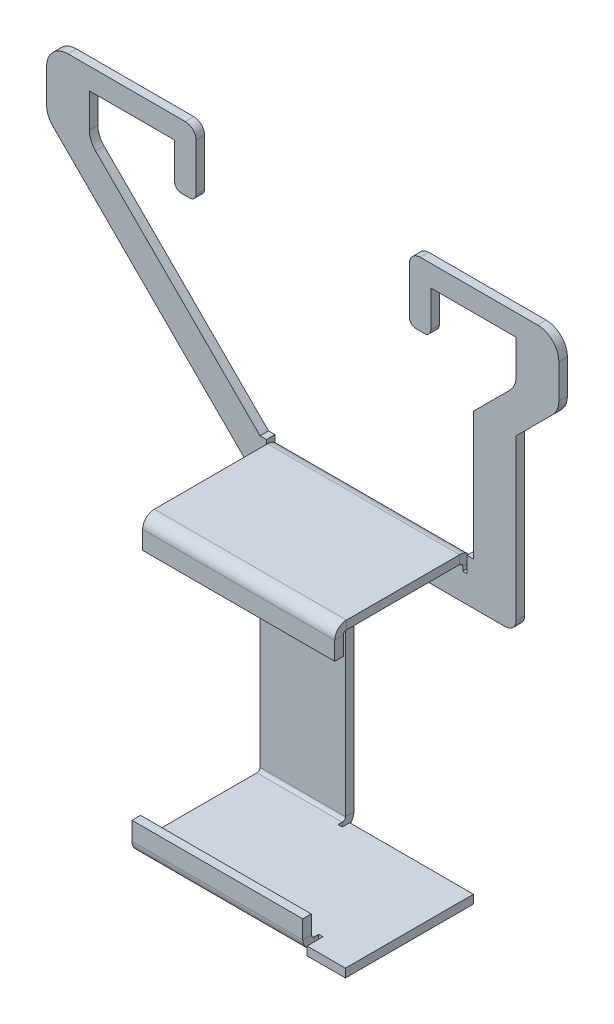
from build123d import *

# Parameters (mm, degrees)
BOSS_EXTRUDE1_DEPTH          = 2
BOSS_EXTRUDE1_2_DEPTH        = 2
BASE_W                       = 20
BASE_H                       = 70
BOSS_EXTRUDE2_DEPTH          = 2
F_3_CM_HANG_LOWER_W          = 50
F_3_CM_HANG_LOWER_H          = 30
BOSS_EXTRUDE3_DEPTH          = 2
F_3CM_HANG_UPPER_W           = 45
F_3CM_HANG_UPPER_H           = 30
BOSS_EXTRUDE4_DEPTH          = 2
LOWER_HOLDER_2ND_EXTEND_W    = 40
LOWER_HOLDER_2ND_EXTEND_H    = 5
BOSS_EXTRUDE5_DEPTH          = 2
UPPER_HOLDER_2ND_EXTEND_W    = 45
UPPER_HOLDER_2ND_EXTEND_H    = 5
BOSS_EXTRUDE6_DEPTH          = 2
FLATTEN_BENDS1_START         = -10
FLATTEN_BENDS1_DEPTH         = 50
FLATTEN_BENDS1_START_2       = -8.5
FLATTEN_BENDS1_2_OUTLINE_W   = 3.7366
FLATTEN_BENDS1_2_OUTLINE_H   = 2
FLATTEN_BENDS1_2_DEPTH       = 1
FLATTEN_BENDS1_START_3       = 37.5
FLATTEN_BENDS1_3_OUTLINE_W   = 3.7366
FLATTEN_BENDS1_3_OUTLINE_H   = 2
FLATTEN_BENDS1_3_DEPTH       = 1
FLATTEN_BENDS1_START_4       = -7.5
FLATTEN_BENDS1_4_OUTLINE_W   = 33.509289802
FLATTEN_BENDS1_4_OUTLINE_H   = 2
FLATTEN_BENDS1_4_OUTLINE_W_2 = 24.5268
FLATTEN_BENDS1_4_DEPTH       = 45
FLATTEN_BENDS1_5_OUTLINE_W   = 32.518044901
FLATTEN_BENDS1_5_OUTLINE_H   = 2
FLATTEN_BENDS1_5_DEPTH       = 39.999999999
FLATTEN_BENDS1_START_5       = 11
FLATTEN_BENDS1_6_OUTLINE_W   = 26.2634
FLATTEN_BENDS1_6_OUTLINE_H   = 2
FLATTEN_BENDS1_6_DEPTH       = 29
FLATTEN_BENDS1_START_6       = 31
FLATTEN_BENDS1_7_OUTLINE_W   = 3.7366
FLATTEN_BENDS1_7_OUTLINE_H   = 2
FLATTEN_BENDS1_7_DEPTH       = 9
FLATTEN_BENDS1_8_OUTLINE_W   = 0.991244901
FLATTEN_BENDS1_8_OUTLINE_H   = 2
FLATTEN_BENDS1_8_DEPTH       = 20
PROCESS_BENDS1_START         = -7.5
PROCESS_BENDS1_DEPTH         = 45
PROCESS_BENDS1_START_2       = -10
PROCESS_BENDS1_2_DEPTH       = 50
PROCESS_BENDS1_START_3       = 11
PROCESS_BENDS1_3_DEPTH       = 29
PROCESS_BENDS1_4_OUTLINE_W   = 2
PROCESS_BENDS1_4_OUTLINE_H   = 24.5268
PROCESS_BENDS1_4_DEPTH       = 45
PROCESS_BENDS1_5_DEPTH       = 39.999999999
PROCESS_BENDS1_6_OUTLINE_W   = 2
PROCESS_BENDS1_6_OUTLINE_H   = 26.2634
PROCESS_BENDS1_6_DEPTH       = 29
PROCESS_BENDS1_7_DEPTH       = 20
PROCESS_BENDS1_START_4       = 31
PROCESS_BENDS1_8_OUTLINE_W   = 2
PROCESS_BENDS1_8_OUTLINE_H   = 3.7366
PROCESS_BENDS1_8_DEPTH       = 9


# Read off the part's stored shape, not the designer's step: Flatten-Bends1, Process-Bends1
with BuildPart() as part:
    # hook → Boss-Extrude1 (new body)
    with BuildSketch(Plane.XY):
        with BuildLine():
            Line((-10, 35), (-10, 25))
            Line((-10, 25), (-58.535533906, 73.535533906))
            ThreePointArc((-58.535533906, 73.535533906), (-59.619397663, 75.15765065), (-60, 77.071067812))
            Line((-60, 77.071067812), (-60, 85))
            ThreePointArc((-60, 85), (-58.535533906, 88.535533906), (-55, 90))
            Line((-55, 90), (-27.5, 90))
            ThreePointArc((-27.5, 90), (-25.732233047, 89.267766953), (-25, 87.5))
            Line((-25, 87.5), (-24.999999999, 76.499999999))
            ThreePointArc((-24.999999999, 76.499999999), (-25.439339828, 75.439339828), (-26.499999999, 74.999999999))
            Line((-26.499999999, 74.999999999), (-28.499999999, 74.999999999))
            ThreePointArc((-28.499999999, 74.999999999), (-29.560660171, 75.439339828), (-29.999999999, 76.499999999))
            Line((-29.999999999, 76.499999999), (-29.999999999, 84.999999999))
            Line((-29.999999999, 84.999999999), (-49.999999999, 84.999999999))
            Line((-49.999999999, 84.999999999), (-50, 77.071067812))
            ThreePointArc((-50, 77.071067812), (-49.619397663, 75.15765065), (-48.535533906, 73.535533906))
            Line((-48.535533906, 73.535533906), (-10, 35))
        make_face()
    extrude(amount=-BOSS_EXTRUDE1_DEPTH)



with BuildPart() as body_2:
    # hook → Boss-Extrude1 2 (new body)
    with BuildSketch(Plane.XY):
        with BuildLine():
            Line((48.535533906, 73.535533906), (40, 65))
            Line((40, 65), (40, 35))
            Line((40, 35), (10, 35))
            Line((10, 35), (10, 25))
            Line((10, 25), (47.5, 25))
            ThreePointArc((47.5, 25), (49.267766953, 25.732233047), (50, 27.5))
            Line((50, 27.5), (50, 65))
            Line((50, 65), (58.535533906, 73.535533906))
            ThreePointArc((58.535533906, 73.535533906), (59.619397663, 75.15765065), (60, 77.071067812))
            Line((60, 77.071067812), (60, 85))
            ThreePointArc((60, 85), (58.535533906, 88.535533906), (55, 90))
            Line((55, 90), (27.5, 90))
            ThreePointArc((27.5, 90), (25.732233047, 89.267766953), (25, 87.5))
            Line((25, 87.5), (24.999999999, 76.499999999))
            ThreePointArc((24.999999999, 76.499999999), (25.439339828, 75.439339828), (26.499999999, 74.999999999))
            Line((26.499999999, 74.999999999), (28.499999999, 74.999999999))
            ThreePointArc((28.499999999, 74.999999999), (29.560660171, 75.439339828), (29.999999999, 76.499999999))
            Line((29.999999999, 76.499999999), (29.999999999, 84.999999999))
            Line((29.999999999, 84.999999999), (49.999999999, 84.999999999))
            Line((49.999999999, 84.999999999), (50, 77.071067812))
            ThreePointArc((50, 77.071067812), (49.619397663, 75.15765065), (48.535533906, 73.535533906))
        make_face()
    extrude(amount=-BOSS_EXTRUDE1_2_DEPTH)


with BuildPart() as part_1:
    add(part.part)

    add(body_2.part)  # Boss-Extrude2 merges body 2
    # base → Boss-Extrude2 (add)
    with BuildSketch(Plane.XY):
        Rectangle(BASE_W, BASE_H)
    extrude(amount=-BOSS_EXTRUDE2_DEPTH)

    # 3cm hang upper → Boss-Extrude4 (add)
    with BuildSketch(Plane(origin=(0, 35, 0), x_dir=(1, 0, 0), z_dir=(0, 1, 0))):
        with Locations((15, -15)):
            Rectangle(F_3CM_HANG_UPPER_W, F_3CM_HANG_UPPER_H)
    extrude(amount=-BOSS_EXTRUDE4_DEPTH)


with BuildPart() as body_2_2:
    # 3 cm hang lower → Boss-Extrude3 (new body)
    with BuildSketch(Plane(origin=(0, -35, 0), x_dir=(1, 0, 0), z_dir=(0, 1, 0))):
        with Locations((15, -15)):
            Rectangle(F_3_CM_HANG_LOWER_W, F_3_CM_HANG_LOWER_H)
    extrude(amount=BOSS_EXTRUDE3_DEPTH)


    add(part_1.part)  # Boss-Extrude5 merges part
    # lower holder 2nd extend → Boss-Extrude5 (add)
    with BuildSketch(Plane.XY.offset(30)):
        with Locations((10, -30.5)):
            Rectangle(LOWER_HOLDER_2ND_EXTEND_W, LOWER_HOLDER_2ND_EXTEND_H)
    extrude(amount=-BOSS_EXTRUDE5_DEPTH)

    # upper holder 2nd extend → Boss-Extrude6 (add)
    with BuildSketch(Plane.XY.offset(30)):
        with Locations((15, 30.5)):
            Rectangle(UPPER_HOLDER_2ND_EXTEND_W, UPPER_HOLDER_2ND_EXTEND_H)
    extrude(amount=-BOSS_EXTRUDE6_DEPTH)

    # Flatten-Bends1 outline → Flatten-Bends1 (cut)
    with BuildSketch(Plane.YZ.offset(FLATTEN_BENDS1_START)):
        Polygon((-33, 0), (-33, 28), (-28, 28), (-28, 30), (-35, 30), (-35, 0), align=None)
        Polygon((33, 28), (33, 0), (35, 0), (35, 30), (28, 30), (28, 28), align=None)
    extrude(amount=FLATTEN_BENDS1_DEPTH, mode=Mode.SUBTRACT)

    # Flatten-Bends1 2 outline → Flatten-Bends1 2 (cut)
    with BuildSketch(Plane.YZ.offset(FLATTEN_BENDS1_START_2)):
        with Locations((33.1317, -1)):
            Rectangle(FLATTEN_BENDS1_2_OUTLINE_W, FLATTEN_BENDS1_2_OUTLINE_H)
    extrude(amount=FLATTEN_BENDS1_2_DEPTH, mode=Mode.SUBTRACT)

    # Flatten-Bends1 3 outline → Flatten-Bends1 3 (cut)
    with BuildSketch(Plane.YZ.offset(FLATTEN_BENDS1_START_3)):
        with Locations((33.1317, -1)):
            Rectangle(FLATTEN_BENDS1_3_OUTLINE_W, FLATTEN_BENDS1_3_OUTLINE_H)
    extrude(amount=FLATTEN_BENDS1_3_DEPTH, mode=Mode.SUBTRACT)

    # Flatten-Bends1 4 outline → Flatten-Bends1 4 (add)
    with BuildSketch(Plane.YZ.offset(FLATTEN_BENDS1_START_4)):
        with Locations((51.754644901, -1)):
            Rectangle(FLATTEN_BENDS1_4_OUTLINE_W, FLATTEN_BENDS1_4_OUTLINE_H)
        with Locations((-48.254644901, -1)):
            Rectangle(FLATTEN_BENDS1_4_OUTLINE_W_2, FLATTEN_BENDS1_4_OUTLINE_H)
    extrude(amount=FLATTEN_BENDS1_4_DEPTH)

    # Flatten-Bends1 5 outline → Flatten-Bends1 5 (add)
    with BuildSketch(Plane.YZ.offset(FLATTEN_BENDS1_START)):
        with Locations((-52.250267351, -1)):
            Rectangle(FLATTEN_BENDS1_5_OUTLINE_W, FLATTEN_BENDS1_5_OUTLINE_H)
    extrude(amount=FLATTEN_BENDS1_5_DEPTH)

    # Flatten-Bends1 6 outline → Flatten-Bends1 6 (add)
    with BuildSketch(Plane.YZ.offset(FLATTEN_BENDS1_START_5)):
        with Locations((-47.386344901, -1)):
            Rectangle(FLATTEN_BENDS1_6_OUTLINE_W, FLATTEN_BENDS1_6_OUTLINE_H)
    extrude(amount=FLATTEN_BENDS1_6_DEPTH)

    # Flatten-Bends1 7 outline → Flatten-Bends1 7 (add)
    with BuildSketch(Plane.YZ.offset(FLATTEN_BENDS1_START_6)):
        with Locations((-62.386344901, -1)):
            Rectangle(FLATTEN_BENDS1_7_OUTLINE_W, FLATTEN_BENDS1_7_OUTLINE_H)
    extrude(amount=FLATTEN_BENDS1_7_DEPTH)

    # Flatten-Bends1 8 outline → Flatten-Bends1 8 (add)
    with BuildSketch(Plane.YZ.offset(FLATTEN_BENDS1_START)):
        with Locations((-35.495622451, -1)):
            Rectangle(FLATTEN_BENDS1_8_OUTLINE_W, FLATTEN_BENDS1_8_OUTLINE_H)
    extrude(amount=FLATTEN_BENDS1_8_DEPTH)

    # Process-Bends1 outline → Process-Bends1 (cut)
    with BuildSketch(Plane.YZ.offset(PROCESS_BENDS1_START)):
        with BuildLine():
            Line((68.509289802, 0), (34.899002398, 0))
            ThreePointArc((34.899002398, 0), (33.917667209, -1.443395312), (32.2634, -2))
            Line((32.2634, -2), (68.509289802, -2))
            Line((68.509289802, -2), (68.509289802, 0))
        make_face()
        with BuildLine():
            Line((-68.509289802, 0), (-68.509289802, -2))
            Line((-68.509289802, -2), (-32.2634, -2))
            ThreePointArc((-32.2634, -2), (-33.917667209, -1.443395312), (-34.899002398, 0))
            Line((-34.899002398, 0), (-68.509289802, 0))
        make_face()
    extrude(amount=PROCESS_BENDS1_DEPTH, mode=Mode.SUBTRACT)

    # Process-Bends1 2 outline → Process-Bends1 2 (cut)
    with BuildSketch(Plane.YZ.offset(PROCESS_BENDS1_START_2)):
        with BuildLine():
            Line((-68.509289802, 0), (-68.509289802, -2))
            Line((-68.509289802, -2), (-32.2634, -2))
            ThreePointArc((-32.2634, -2), (-33.917667209, -1.443395312), (-34.899002398, 0))
            Line((-34.899002398, 0), (-68.509289802, 0))
        make_face()
    extrude(amount=PROCESS_BENDS1_2_DEPTH, mode=Mode.SUBTRACT)

    # Process-Bends1 3 outline → Process-Bends1 3 (cut)
    with BuildSketch(Plane.YZ.offset(PROCESS_BENDS1_START_3)):
        with BuildLine():
            Line((-34.254644901, 0), (-34.899002398, 0))
            ThreePointArc((-34.899002398, 0), (-34.646082873, -0.609431903), (-34.254644901, -1.140611576))
            Line((-34.254644901, -1.140611576), (-34.254644901, 0))
        make_face()
    extrude(amount=PROCESS_BENDS1_3_DEPTH, mode=Mode.SUBTRACT)

    # Process-Bends1 4 outline → Process-Bends1 4 (add)
    with BuildSketch(Plane.YZ.offset(PROCESS_BENDS1_START)):
        with BuildLine():
            Line((32.2634, 30), (28, 30))
            Line((28, 30), (28, 28))
            Line((28, 28), (32.2634, 28))
            ThreePointArc((32.2634, 28), (32.784254855, 27.784254855), (33, 27.2634))
            Line((33, 27.2634), (33, 0.7366))
            ThreePointArc((33, 0.7366), (32.784254855, 0.215745145), (32.2634, 0))
            Line((32.2634, 0), (34.899002398, 0))
            ThreePointArc((34.899002398, 0), (34.974633029, 0.364854094), (35, 0.7366))
            Line((35, 0.7366), (35, 27.2634))
            ThreePointArc((35, 27.2634), (34.198468417, 29.198468417), (32.2634, 30))
        make_face()
        with Locations((-34, 14)):
            Rectangle(PROCESS_BENDS1_4_OUTLINE_W, PROCESS_BENDS1_4_OUTLINE_H)
    extrude(amount=PROCESS_BENDS1_4_DEPTH)

    # Process-Bends1 5 outline → Process-Bends1 5 (add)
    with BuildSketch(Plane.YZ.offset(PROCESS_BENDS1_START_2)):
        with BuildLine():
            Line((-28, 30), (-32.2634, 30))
            ThreePointArc((-32.2634, 30), (-34.198468417, 29.198468417), (-35, 27.2634))
            Line((-35, 27.2634), (-35, 1.7366))
            Line((-35, 1.7366), (-33, 1.7366))
            Line((-33, 1.7366), (-33, 27.2634))
            ThreePointArc((-33, 27.2634), (-32.784254855, 27.784254855), (-32.2634, 28))
            Line((-32.2634, 28), (-28, 28))
            Line((-28, 28), (-28, 30))
        make_face()
    extrude(amount=PROCESS_BENDS1_5_DEPTH)

    # Process-Bends1 6 outline → Process-Bends1 6 (add)
    with BuildSketch(Plane.YZ.offset(PROCESS_BENDS1_START_3)):
        with Locations((-34, 13.1317)):
            Rectangle(PROCESS_BENDS1_6_OUTLINE_W, PROCESS_BENDS1_6_OUTLINE_H)
    extrude(amount=PROCESS_BENDS1_6_DEPTH)

    # Process-Bends1 7 outline → Process-Bends1 7 (add)
    with BuildSketch(Plane.YZ.offset(PROCESS_BENDS1_START_2)):
        with BuildLine():
            Line((-33, 0.7366), (-33, 1.7366))
            Line((-33, 1.7366), (-35, 1.7366))
            Line((-35, 1.7366), (-35, 0.7366))
            ThreePointArc((-35, 0.7366), (-34.974633029, 0.364854094), (-34.899002398, 0))
            Line((-34.899002398, 0), (-32.2634, 0))
            ThreePointArc((-32.2634, 0), (-32.784254855, 0.215745145), (-33, 0.7366))
        make_face()
    extrude(amount=PROCESS_BENDS1_7_DEPTH)

    # Process-Bends1 8 outline → Process-Bends1 8 (add)
    with BuildSketch(Plane.YZ.offset(PROCESS_BENDS1_START_4)):
        with Locations((-34, 28.1317)):
            Rectangle(PROCESS_BENDS1_8_OUTLINE_W, PROCESS_BENDS1_8_OUTLINE_H)
    extrude(amount=PROCESS_BENDS1_8_DEPTH)


solid = body_2_2.part
